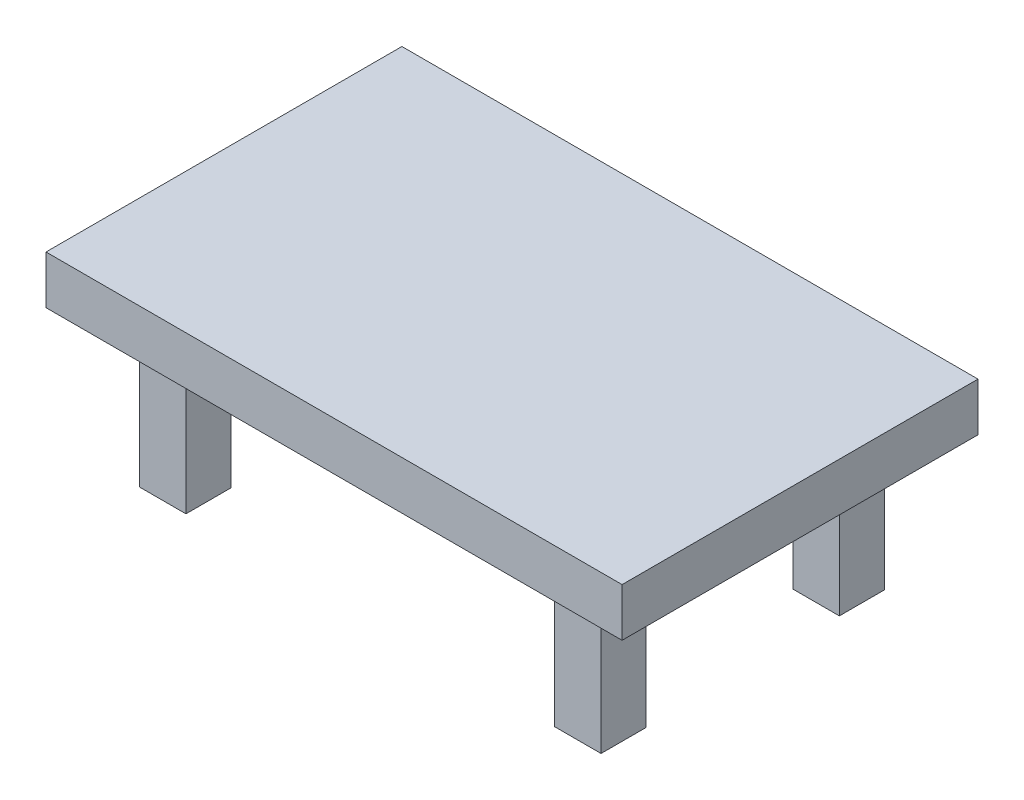
from build123d import *

# Parameters (mm, degrees)
SKETCH1_W      = 2425.7
SKETCH1_H      = 1498.6
EXTRUDE1_DEPTH = 203.2
SKETCH2_W      = 195.697690122
SKETCH2_H      = 190.200978844
EXTRUDE2_DEPTH = 609.6


with BuildPart() as part:
    # Sketch1 → Extrude1 (new body)
    with BuildSketch(Plane(origin=(0, 0, 0), x_dir=(1, 0, 0), z_dir=(0, 1, 0))):
        Rectangle(SKETCH1_W, SKETCH1_H)
    extrude(amount=EXTRUDE1_DEPTH)

    # Sketch2 → Extrude2 (add)
    with BuildSketch(Plane.XZ):
        with Locations((873.896069805, 501.711153283)):
            Rectangle(SKETCH2_W, SKETCH2_H)
        with Locations((-873.896069805, 501.711153283)):
            Rectangle(SKETCH2_W, SKETCH2_H)
        with Locations((-873.896069805, -501.711153283)):
            Rectangle(SKETCH2_W, SKETCH2_H)
        with Locations((873.896069805, -501.711153283)):
            Rectangle(SKETCH2_W, SKETCH2_H)
    extrude(amount=EXTRUDE2_DEPTH)


solid = part.part
